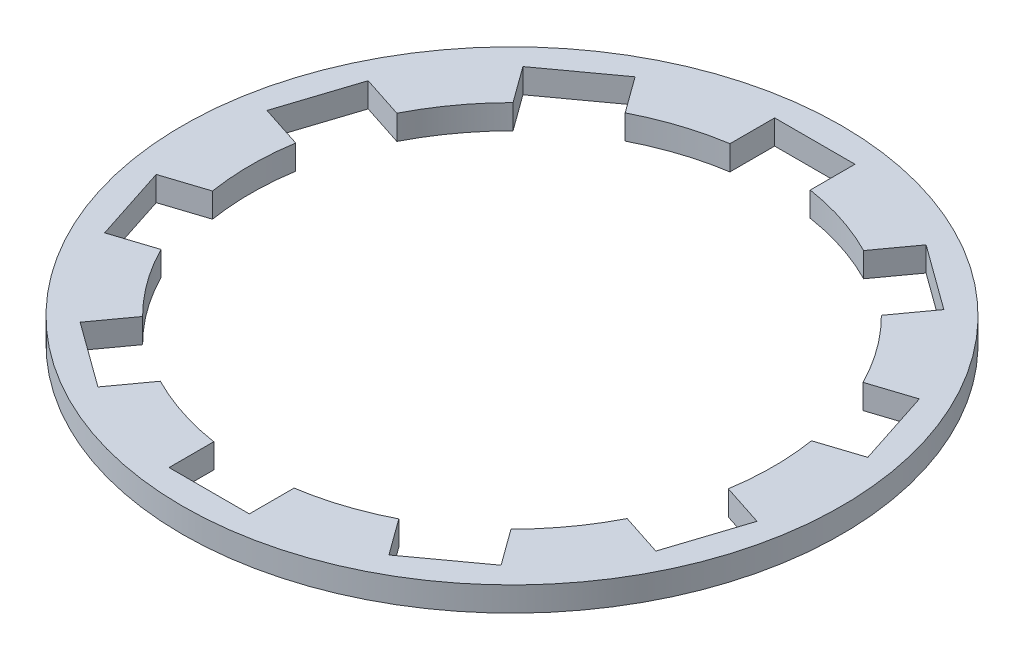
from build123d import *

# Parameters (mm, degrees)
SKETCH1_R           = 7.5311
SKETCH1_R_2         = 5.969
BOSS_EXTRUDE1_DEPTH = 0.5588
SKETCH2_W           = 1.834896806
SKETCH2_H           = 1.901806754
CUT_EXTRUDE1_DEPTH  = 11.665232855
CIRPATTERN1_COUNT   = 10


with BuildPart() as part:
    # Sketch1 → Boss-Extrude1 (new body)
    with BuildSketch(Plane(origin=(0, 0, 0), x_dir=(1, 0, 0), z_dir=(0, 1, 0))):
        Circle(SKETCH1_R)
        Circle(SKETCH1_R_2, mode=Mode.SUBTRACT)
    extrude(amount=BOSS_EXTRUDE1_DEPTH)

    # Sketch2 → Cut-Extrude1 (cut, through all)
    with BuildSketch(Plane(origin=(0, 0.5588, 0), x_dir=(1, 0, 0), z_dir=(0, 1, 0))):
        with Locations((0, 5.969)):
            Rectangle(SKETCH2_W, SKETCH2_H)
    cut_extrude1 = extrude(amount=-CUT_EXTRUDE1_DEPTH, mode=Mode.SUBTRACT)

    # CirPattern1: Cut-Extrude1 ×10 about axis
    cirpattern1_axis = Axis((0, 0.5588, 0), (0, -1, 0))
    for i in range(1, CIRPATTERN1_COUNT):
        add(cut_extrude1.rotate(cirpattern1_axis, i * 360 / CIRPATTERN1_COUNT), mode=Mode.SUBTRACT)


solid = part.part
